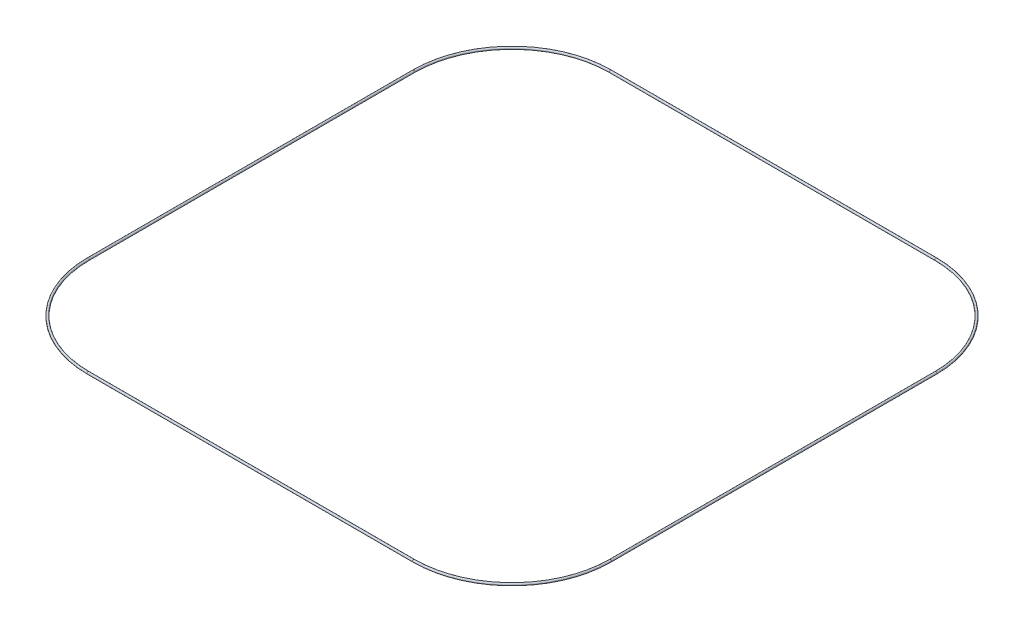
from build123d import *

# Parameters (mm, degrees)
SKETCH3_R = 1.5875


with BuildPart() as part:
    # Sweep2: sweep along a path in Sketch1
    with BuildLine(Plane(origin=(0, 0, 0), x_dir=(1, 0, 0), z_dir=(0, 1, 0))) as sweep2_path:
        Line((139.7, 0), (601.98, 0))
        ThreePointArc((601.98, 0), (700.762817332, 40.917182668), (741.68, 139.7))
        Line((741.68, 139.7), (741.68, 601.98))
        ThreePointArc((741.68, 601.98), (700.762817332, 700.762817332), (601.98, 741.68))
        Line((601.98, 741.68), (139.7, 741.68))
        ThreePointArc((139.7, 741.68), (40.917182668, 700.762817332), (0, 601.98))
        Line((0, 601.98), (0, 139.7))
        ThreePointArc((0, 139.7), (40.917182668, 40.917182668), (139.7, 0))
    # Sketch3 → Sweep2 (sweep)
    with BuildSketch(Plane(origin=(0, 0, -139.7), x_dir=(-1, 0, 0), z_dir=(0, 0, -1))):
        Circle(SKETCH3_R)
    sweep(path=sweep2_path.line)


solid = part.part
